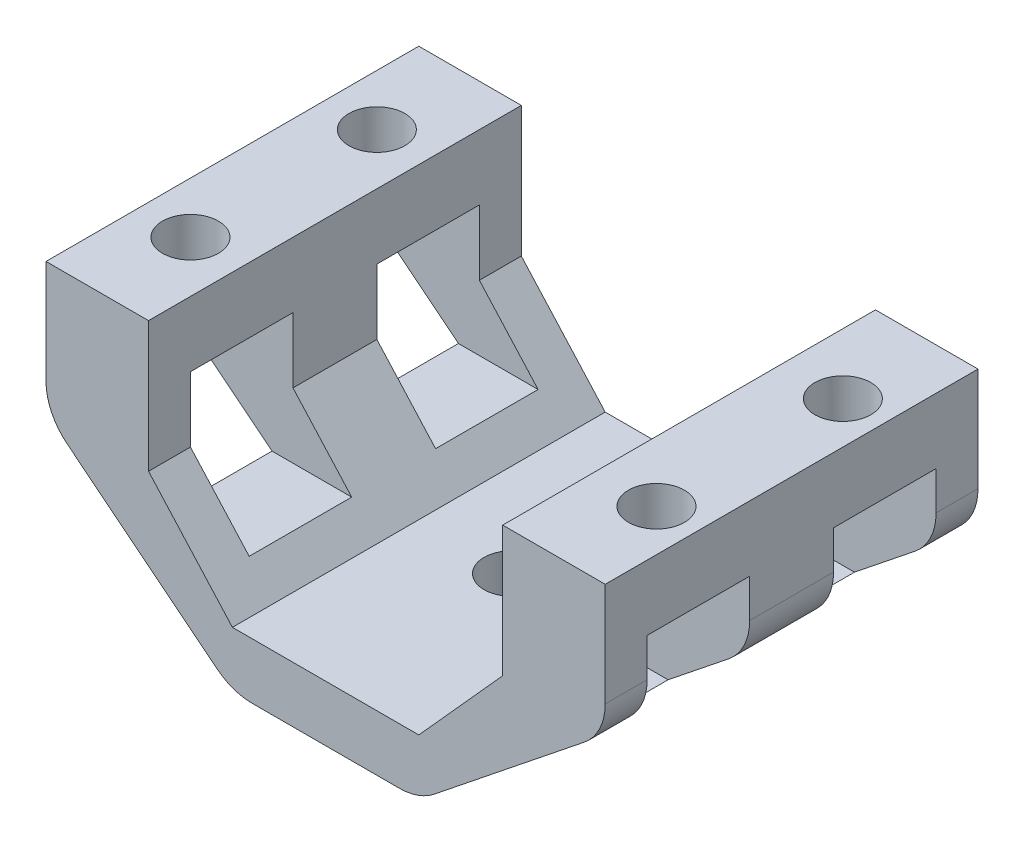
from build123d import *

# Parameters (mm, degrees)
SALIENTE_EXTRUIR1_DEPTH = 20
CROQUIS2_W              = 5.5
CROQUIS2_H              = 7
CORTAR_EXTRUIR3_DEPTH   = 37.932370625
CROQUIS3_R              = 1.5
CORTAR_EXTRUIR4_DEPTH   = 33.015621187
REDONDEO1_R             = 3
CROQUIS4_R              = 1.5
CORTAR_EXTRUIR5_DEPTH   = 31.724582991


with BuildPart() as part:
    # Croquis1 → Saliente-Extruir1 (new body)
    with BuildSketch(Plane.XY):
        Polygon((0, -5), (-4.5, 0), (-4.5, 7), (-10, 7), (-10, 0), (0, -8), (10, -8), (20, 0), (20, 7), (14.5, 7), (14.5, 0), (10, -5), align=None)
    extrude(amount=SALIENTE_EXTRUIR1_DEPTH)

    # Croquis2 → Cortar-Extruir3 (cut, through all)
    with BuildSketch(Plane.ZY.offset(10)):
        with Locations((15, 0)):
            Rectangle(CROQUIS2_W, CROQUIS2_H)
        with Locations((5, 0)):
            Rectangle(CROQUIS2_W, CROQUIS2_H)
    extrude(amount=-CORTAR_EXTRUIR3_DEPTH, mode=Mode.SUBTRACT)

    # Croquis3 → Cortar-Extruir4 (cut, through all)
    with BuildSketch(Plane(origin=(0, 7, 0), x_dir=(1, 0, 0), z_dir=(0, 1, 0))):
        with Locations((-7.25, -5)):
            Circle(CROQUIS3_R)
        with Locations((17.75, -5)):
            Circle(CROQUIS3_R)
        with Locations((17.75, -15)):
            Circle(CROQUIS3_R)
        with Locations((-7.25, -15)):
            Circle(CROQUIS3_R)
    extrude(amount=-CORTAR_EXTRUIR4_DEPTH, mode=Mode.SUBTRACT)

    # Redondeo1
    redondeo1_edges = [part.edges().sort_by_distance(p)[0] for p in [
        (10, -8, 10),
        (20, 0, 1.125),
        (20, 0, 18.875),
        (20, 0, 10),
        (0, -8, 10),
        (-10, 0, 18.875),
        (-10, 0, 1.125),
        (-10, 0, 10),
    ]]
    fillet(redondeo1_edges, radius=REDONDEO1_R)

    # Croquis4 → Cortar-Extruir5 (cut, through all)
    with BuildSketch(Plane(origin=(0, -5, 0), x_dir=(1, 0, 0), z_dir=(0, 1, 0))):
        with Locations((5, -10)):
            Circle(CROQUIS4_R)
    extrude(amount=-CORTAR_EXTRUIR5_DEPTH, mode=Mode.SUBTRACT)


solid = part.part
